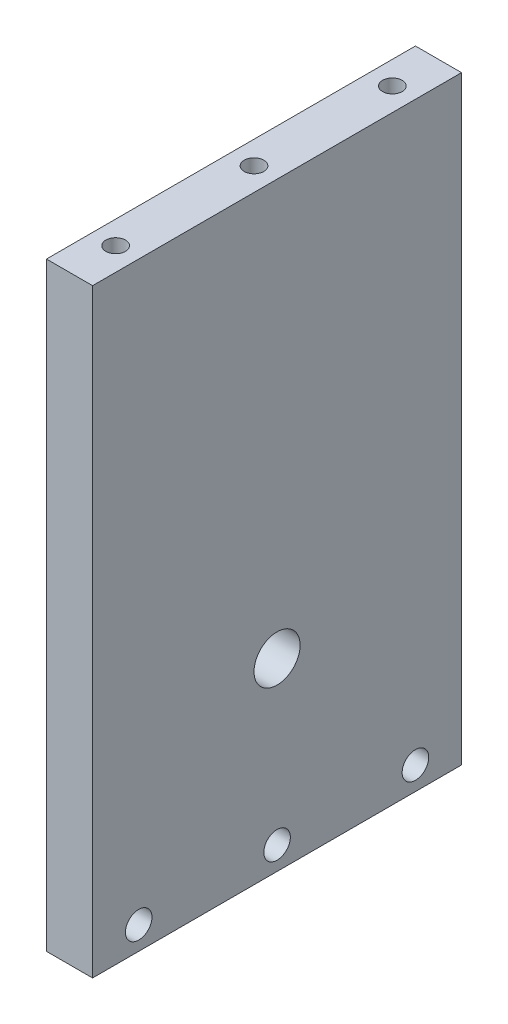
from build123d import *

# Parameters (mm, degrees)
SKETCH1_W                 = 50.8
SKETCH1_H                 = 82.55
BOSS_EXTRUDE1_DEPTH       = 6.35
SKETCH3_R                 = 1.8288
CUT_EXTRUDE1_DEPTH        = 6.35
F_6_32_TAPPED_HOLE1_D     = 2.7051
F_6_32_TAPPED_HOLE1_DEPTH = 11.88730597
F_6_32_TAPPED_HOLE1_TIP   = 0.81269403
SKETCH12_R                = 3.175
CUT_EXTRUDE3_DEPTH        = 6.35


with BuildPart() as part:
    # Sketch1 → Boss-Extrude1 (new body)
    with BuildSketch(Plane(origin=(0, 0, 0), x_dir=(0, 0, -1), z_dir=(1, 0, 0))):
        with Locations((-25.4, 41.275)):
            Rectangle(SKETCH1_W, SKETCH1_H)
    extrude(amount=BOSS_EXTRUDE1_DEPTH)

    # Sketch3 → Cut-Extrude1 (cut)
    with BuildSketch(Plane(origin=(6.35, 0, 0), x_dir=(0, 0, -1), z_dir=(1, 0, 0))):
        with Locations((-44.45, 3.175)):
            Circle(SKETCH3_R)
        with Locations((-25.4, 3.175)):
            Circle(SKETCH3_R)
        with Locations((-6.35, 3.175)):
            Circle(SKETCH3_R)
    extrude(amount=-CUT_EXTRUDE1_DEPTH, mode=Mode.SUBTRACT)

    # #6-32 Tapped Hole1
    with Locations(Plane(origin=(0, 82.55, 0), x_dir=(1, 0, 0), z_dir=(0, 1, 0))):
        with Locations((3.175, -6.35), (3.175, -25.4), (3.175, -44.45)):
            Hole(F_6_32_TAPPED_HOLE1_D / 2, depth=F_6_32_TAPPED_HOLE1_DEPTH)
            with Locations((0, 0, -(F_6_32_TAPPED_HOLE1_DEPTH + F_6_32_TAPPED_HOLE1_TIP / 2))):  # 118° drill point
                Cone(0, F_6_32_TAPPED_HOLE1_D / 2, F_6_32_TAPPED_HOLE1_TIP, mode=Mode.SUBTRACT)

    # Sketch12 → Cut-Extrude3 (cut)
    with BuildSketch(Plane(origin=(6.35, 0, 0), x_dir=(0, 0, -1), z_dir=(1, 0, 0))):
        with Locations((-25.4, 25.4)):
            Circle(SKETCH12_R)
    extrude(amount=-CUT_EXTRUDE3_DEPTH, mode=Mode.SUBTRACT)


solid = part.part
